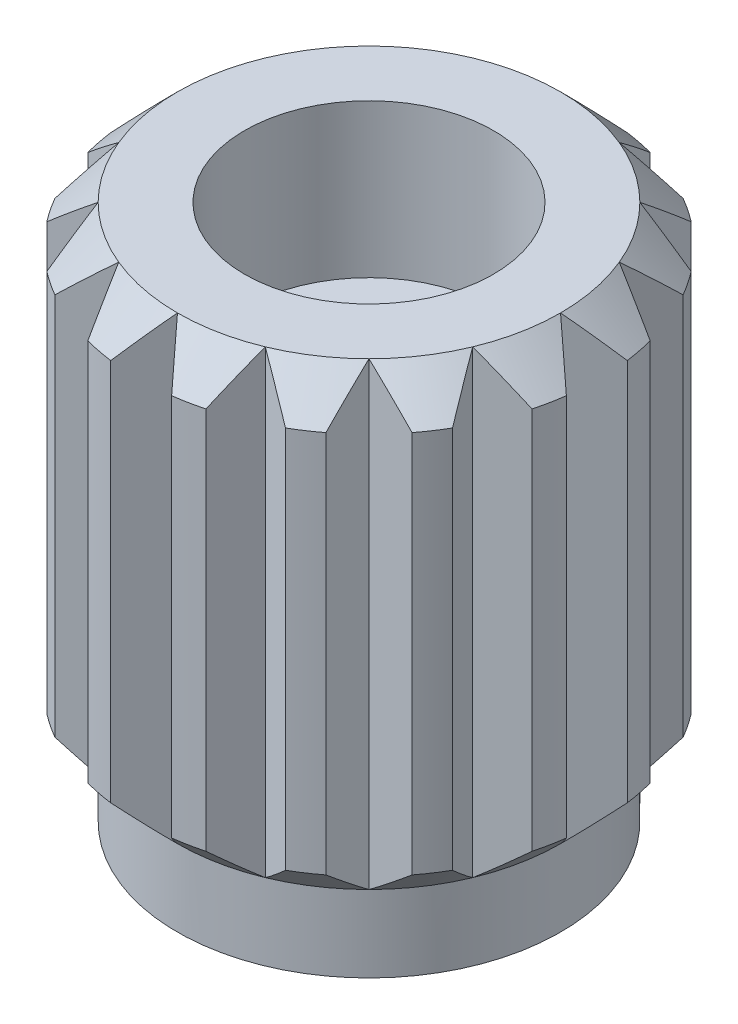
from build123d import *

# Parameters (mm, degrees)
ESQUISSE1_R                                     = 6
BOSS_EXTRU_1_DEPTH                              = 14
ESQUISSE2_OUTSIDE_W                             = 18.4
ESQUISSE2_OUTSIDE_H                             = 18.4
ESQUISSE2_OUTSIDE_R                             = 5
ENL_V_MAT_EXTRU_1_DEPTH                         = 2
CHANFREIN1_SIZE                                 = 1
CHAMBRAGE_POUR_VIS_T_TE_CYLINDRIQUE_D           = 3.2
CHAMBRAGE_POUR_VIS_T_TE_CYLINDRIQUE_CBORE_D     = 6.5
CHAMBRAGE_POUR_VIS_T_TE_CYLINDRIQUE_CBORE_DEPTH = 4
ENL_V_MAT_EXTRU_3_DEPTH                         = 3
ENL_V_MAT_EXTRU_2_DEPTH                         = 17.370705544
R_P_TITION_START                                = 1.9999999
R_P_TITION_CIRCULAIRE1_DEPTH                    = 12.0000002


# Read off the part's stored shape, not the designer's step: Répétition circulaire1
with BuildPart() as part:
    # Esquisse1 → Boss.-Extru.1 (new body)
    with BuildSketch(Plane(origin=(0, 0, 0), x_dir=(1, 0, 0), z_dir=(0, 1, 0))):
        with Locations(Location((0, 0, 0), (0, 0, 270))):
            Circle(ESQUISSE1_R)
    extrude(amount=BOSS_EXTRU_1_DEPTH)

    # Esquisse2 outside → Enlèv. mat.-Extru.1 (cut)
    with BuildSketch(Plane.XZ):
        Rectangle(ESQUISSE2_OUTSIDE_W, ESQUISSE2_OUTSIDE_H)
        with Locations(Location((0, 0, 0), (0, 0, 270))):
            Circle(ESQUISSE2_OUTSIDE_R, mode=Mode.SUBTRACT)
    extrude(amount=-ENL_V_MAT_EXTRU_1_DEPTH, mode=Mode.SUBTRACT)

    # Chanfrein1
    chanfrein1_edges = [part.edges().sort_by_distance(p)[0] for p in [
        (0, 14, -6),
        (0, 2, -6),
    ]]
    chamfer(chanfrein1_edges, length=CHANFREIN1_SIZE - 0.0001)  # a hair under: the kernel refuses the full size

    # Chambrage pour vis à tête cylindrique à 6 pans creux (ou vis CHC) M31 (through all)
    with Locations(Plane(origin=(0, 14, 0), x_dir=(1, 0, 0), z_dir=(0, 1, 0))):
        with Locations((0, 0)):
            CounterBoreHole(CHAMBRAGE_POUR_VIS_T_TE_CYLINDRIQUE_D / 2, CHAMBRAGE_POUR_VIS_T_TE_CYLINDRIQUE_CBORE_D / 2, CHAMBRAGE_POUR_VIS_T_TE_CYLINDRIQUE_CBORE_DEPTH)

    # Esquisse6 → Enlèv. mat.-Extru.3 (cut)
    with BuildSketch(Plane.XZ):
        Polygon((1.525603556, 2.784935749), (-1.649023328, 2.71367931), (-3.174626884, -0.071256439), (-1.525603556, -2.784935749), (1.649023328, -2.71367931), (3.174626884, 0.071256439), align=None)
    extrude(amount=-ENL_V_MAT_EXTRU_3_DEPTH, mode=Mode.SUBTRACT)

    # Esquisse5 → Enlèv. mat.-Extru.2 (cut, through all)
    with BuildSketch(Plane(origin=(0, 14, 0), x_dir=(1, 0, 0), z_dir=(0, 1, 0))):
        Polygon((-5, 0), (-6.645642825, 1.380858287), (-6.645642825, -1.380858287), align=None)
    extrude(amount=-ENL_V_MAT_EXTRU_2_DEPTH, mode=Mode.SUBTRACT)

    # Répétition circulaire1 outline → Répétition circulaire1 (cut)
    with BuildSketch(Plane(origin=(0, 0, 0), x_dir=(1, 0, 0), z_dir=(0, 1, 0)).offset(R_P_TITION_START)):
        with BuildLine():
            ThreePointArc((-5.798567798, -1.541626246), (-5.543277195, -2.296100594), (-5.190300984, -3.010112239))
            Line((-5.190300984, -3.010112239), (-4.619397663, -1.913417162))
            Line((-4.619397663, -1.913417162), (-5.798567798, -1.541626246))
        make_face()
        with BuildLine():
            Line((-4.619397663, 1.913417162), (-5.190300984, 3.010112239))
            ThreePointArc((-5.190300984, 3.010112239), (-5.543277195, 2.296100594), (-5.798567798, 1.541626246))
            Line((-5.798567798, 1.541626246), (-4.619397663, 1.913417162))
        make_face()
        with BuildLine():
            Line((-3.535533906, 3.535533906), (-3.643292763, 4.767223284))
            ThreePointArc((-3.643292763, 4.767223284), (-4.242640687, 4.242640687), (-4.767223284, 3.643292763))
            Line((-4.767223284, 3.643292763), (-3.535533906, 3.535533906))
        make_face()
        with BuildLine():
            Line((-1.913417162, 4.619397663), (-1.541626246, 5.798567799))
            ThreePointArc((-1.541626246, 5.798567799), (-2.296100594, 5.543277195), (-3.010112239, 5.190300984))
            Line((-3.010112239, 5.190300984), (-1.913417162, 4.619397663))
        make_face()
        with BuildLine():
            Line((0, 5), (0.794738893, 5.94713293))
            ThreePointArc((0.794738893, 5.94713293), (0, 6), (-0.794738893, 5.94713293))
            Line((-0.794738893, 5.94713293), (0, 5))
        make_face()
        with BuildLine():
            Line((1.913417162, 4.619397663), (3.010112239, 5.190300984))
            ThreePointArc((3.010112239, 5.190300984), (2.296100594, 5.543277195), (1.541626246, 5.798567799))
            Line((1.541626246, 5.798567799), (1.913417162, 4.619397663))
        make_face()
        with BuildLine():
            Line((3.535533906, 3.535533906), (4.767223284, 3.643292763))
            ThreePointArc((4.767223284, 3.643292763), (4.242640687, 4.242640687), (3.643292763, 4.767223284))
            Line((3.643292763, 4.767223284), (3.535533906, 3.535533906))
        make_face()
        with BuildLine():
            Line((4.619397663, 1.913417162), (5.798567799, 1.541626246))
            ThreePointArc((5.798567799, 1.541626246), (5.543277195, 2.296100594), (5.190300984, 3.010112239))
            Line((5.190300984, 3.010112239), (4.619397663, 1.913417162))
        make_face()
        with BuildLine():
            Line((5, 0), (5.94713293, -0.794738893))
            ThreePointArc((5.94713293, -0.794738893), (6, 0), (5.94713293, 0.794738893))
            Line((5.94713293, 0.794738893), (5, 0))
        make_face()
        with BuildLine():
            Line((4.619397663, -1.913417162), (5.190300984, -3.010112239))
            ThreePointArc((5.190300984, -3.010112239), (5.543277195, -2.296100594), (5.798567799, -1.541626246))
            Line((5.798567799, -1.541626246), (4.619397663, -1.913417162))
        make_face()
        with BuildLine():
            Line((3.535533906, -3.535533906), (3.643292763, -4.767223284))
            ThreePointArc((3.643292763, -4.767223284), (4.242640687, -4.242640687), (4.767223284, -3.643292763))
            Line((4.767223284, -3.643292763), (3.535533906, -3.535533906))
        make_face()
        with BuildLine():
            Line((1.913417162, -4.619397663), (1.541626246, -5.798567799))
            ThreePointArc((1.541626246, -5.798567799), (2.296100594, -5.543277195), (3.010112239, -5.190300984))
            Line((3.010112239, -5.190300984), (1.913417162, -4.619397663))
        make_face()
        with BuildLine():
            Line((0, -5), (-0.794738893, -5.94713293))
            ThreePointArc((-0.794738893, -5.94713293), (0, -6), (0.794738893, -5.94713293))
            Line((0.794738893, -5.94713293), (0, -5))
        make_face()
        with BuildLine():
            Line((-1.913417162, -4.619397663), (-3.010112239, -5.190300984))
            ThreePointArc((-3.010112239, -5.190300984), (-2.296100594, -5.543277195), (-1.541626246, -5.798567799))
            Line((-1.541626246, -5.798567799), (-1.913417162, -4.619397663))
        make_face()
        with BuildLine():
            Line((-3.535533906, -3.535533906), (-4.767223284, -3.643292763))
            ThreePointArc((-4.767223284, -3.643292763), (-4.242640687, -4.242640687), (-3.643292763, -4.767223284))
            Line((-3.643292763, -4.767223284), (-3.535533906, -3.535533906))
        make_face()
    extrude(amount=R_P_TITION_CIRCULAIRE1_DEPTH, mode=Mode.SUBTRACT)


solid = part.part
